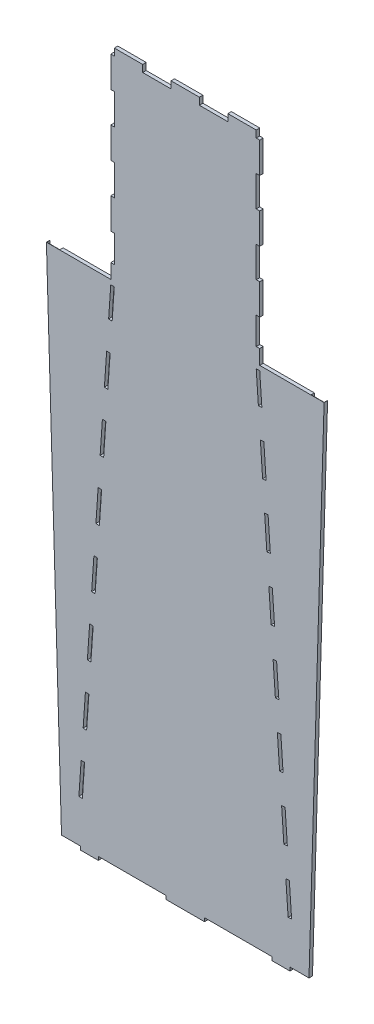
from build123d import *

# Parameters (mm, degrees)
BOSS_EXTRUDE1_DEPTH = 10.16
CUT_LOFT1_START     = 319.572758977
CUT_LOFT1_OUTLINE_W = 1472
CUT_LOFT1_OUTLINE_H = 11.5
CUT_LOFT1_DEPTH     = 38.082840263


# Read off the part's stored shape, not the designer's step: Cut-Loft1
with BuildPart() as part:
    # Sketch1 → Boss-Extrude1 (new body)
    # profile 1 of 2: a face of its own
    with BuildSketch(Plane.XY):
        Polygon((205.715298803, 2062.48), (123.444, 2062.48), (123.444, 2042.16), (41.135649402, 2042.16), (41.135649402, 2062.48), (-41.135649402, 2062.48), (-41.135649402, 2042.16), (-123.444, 2042.16), (-123.444, 2062.48), (-205.715298803, 2062.48), (-205.715298803, 2042.16), (-215.881789204, 2042.16), (-215.881789204, 1953.26), (-205.715298803, 1953.26), (-205.715298803, 1864.36), (-215.881789204, 1864.36), (-215.881789204, 1775.46), (-205.715298803, 1775.46), (-205.715298803, 1686.56), (-215.875298803, 1686.56), (-215.875298803, 1597.66), (-205.715298803, 1597.66), (-205.715298803, 1518.92), (205.715298803, 1518.92), (205.715298803, 1597.66), (215.875298803, 1597.66), (215.875298803, 1686.56), (205.715298803, 1686.56), (205.715298803, 1775.46), (215.881789204, 1775.46), (215.881789204, 1864.36), (205.715298803, 1864.36), (205.715298803, 1953.26), (215.881789204, 1953.26), (215.881789204, 2042.16), (205.715298803, 2042.16), align=None)
    # profile 2 of 2: a face of its own
    with BuildSketch(Plane.XY):
        Polygon((215.881789204, 1518.92), (205.715298803, 1518.92), (-205.715298803, 1518.92), (-215.881789204, 1518.92), (-215.881789204, 1476.636861244), (-402.453189401, 1476.636861244), (-358.672996954, 10.16), (-303.52, 10.16), (-303.52, 0), (-252, 0), (-252, 10.16), (-55.8292, 10.16), (-55.8292, 0), (55.8292, 0), (55.8292, 10.16), (252, 10.16), (252, 0), (303.52, 0), (303.52, 10.16), (358.672996954, 10.16), (402.453189401, 1476.636861244), (215.881789204, 1476.636861244), align=None)
        Polygon((-308.266124544, 132.94397688), (-301.755453134, 226.680843836), (-291.63777305, 225.978101227), (-298.14844446, 132.241234271), align=None, mode=Mode.SUBTRACT)
        Polygon((-289.435698895, 404.053512688), (-279.318018811, 403.350770078), (-285.830533081, 309.587370692), (-295.948213166, 310.290113301), align=None, mode=Mode.SUBTRACT)
        Polygon((-283.630301787, 487.636249721), (-277.115944656, 581.426181539), (-266.998264572, 580.72343893), (-273.512621703, 486.933507112), align=None, mode=Mode.SUBTRACT)
        Polygon((-264.796190418, 758.798850391), (-254.678510334, 758.096107781), (-261.194710324, 664.279643533), (-271.312390408, 664.982386142), align=None, mode=Mode.SUBTRACT)
        Polygon((-252.476436179, 936.171519242), (-242.358756095, 935.468776633), (-248.876798945, 841.625779953), (-258.99447903, 842.328522563), align=None, mode=Mode.SUBTRACT)
        Polygon((301.755453134, 226.680843836), (308.266124544, 132.94397688), (298.14844446, 132.241234271), (291.63777305, 225.978101227), align=None, mode=Mode.SUBTRACT)
        Polygon((279.318018811, 403.350770078), (289.435698895, 404.053512688), (295.948213166, 310.290113301), (285.830533081, 309.587370692), align=None, mode=Mode.SUBTRACT)
        Polygon((277.115944656, 581.426181539), (283.630301787, 487.636249721), (273.512621703, 486.933507112), (266.998264572, 580.72343893), align=None, mode=Mode.SUBTRACT)
        Polygon((254.678510334, 758.096107781), (264.796190418, 758.798850391), (271.312390408, 664.982386142), (261.194710324, 664.279643533), align=None, mode=Mode.SUBTRACT)
        Polygon((242.358756095, 935.468776633), (252.476436179, 936.171519242), (258.99447903, 842.328522563), (248.876798945, 841.625779953), align=None, mode=Mode.SUBTRACT)
        Polygon((-240.15668194, 1113.544188093), (-230.039001856, 1112.841445484), (-236.558887567, 1018.971916374), (-246.676567651, 1019.674658983), align=None, mode=Mode.SUBTRACT)
        Polygon((-227.836927701, 1290.916856945), (-217.719247617, 1290.214114336), (-224.240976188, 1196.318052795), (-234.358656272, 1197.020795404), align=None, mode=Mode.SUBTRACT)
        Polygon((-206.420980822, 1452.880000035), (-211.92306481, 1373.664189215), (-222.040744894, 1374.366931824), (-215.881789204, 1463.040000035), (-205.715298803, 1463.040000035), align=None, mode=Mode.SUBTRACT)
        Polygon((230.039001856, 1112.841445484), (240.15668194, 1113.544188093), (246.676567651, 1019.674658983), (236.558887567, 1018.971916374), align=None, mode=Mode.SUBTRACT)
        Polygon((217.719247617, 1290.214114336), (227.836927701, 1290.916856945), (234.358656272, 1197.020795404), (224.240976188, 1196.318052795), align=None, mode=Mode.SUBTRACT)
        Polygon((205.715298803, 1463.040000035), (215.881789204, 1463.040000035), (222.040744894, 1374.366931824), (211.92306481, 1373.664189215), (206.420980822, 1452.880000035), align=None, mode=Mode.SUBTRACT)
    extrude(amount=BOSS_EXTRUDE1_DEPTH)

    # Cut-Loft1 outline → Cut-Loft1 (cut)
    with BuildSketch(Plane(origin=(0, 0, 0), x_dir=(0.030009511302642098, 0.9995496131915498, 0), z_dir=(0.9995496131915498, -0.030009511302642095, 0)).offset(CUT_LOFT1_START)):
        with Locations((754, 3.75)):
            Rectangle(CUT_LOFT1_OUTLINE_W, CUT_LOFT1_OUTLINE_H)
    cut_loft1 = extrude(amount=CUT_LOFT1_DEPTH, mode=Mode.SUBTRACT)

    # Mirror1: Cut-Loft1 across plane
    add(cut_loft1.mirror(Plane(origin=(0, 0, 0), x_dir=(0, 0, 1), z_dir=(1, 0, 0))), mode=Mode.SUBTRACT)


solid = part.part
